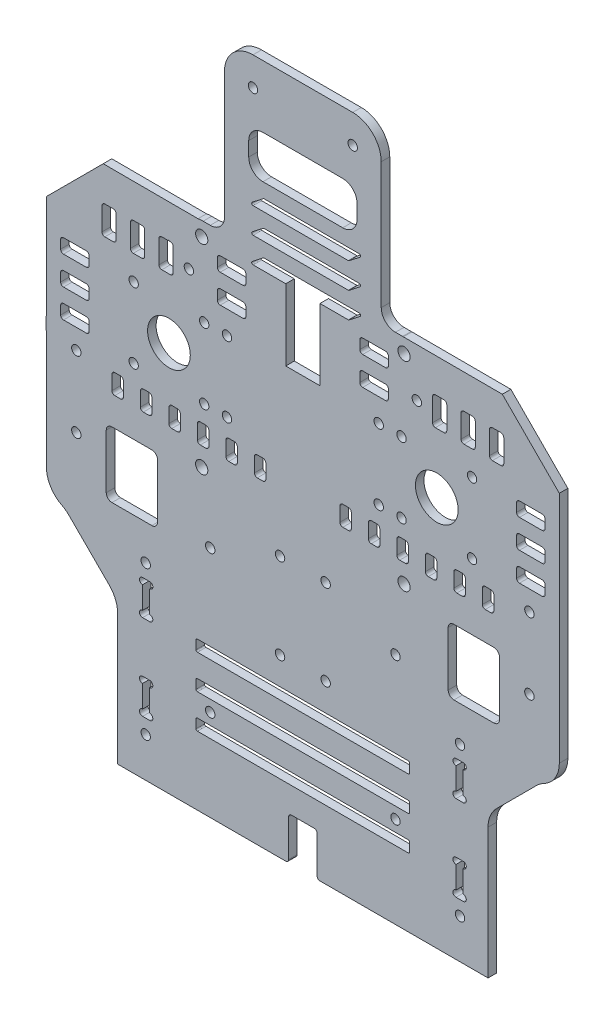
from build123d import *
from OCP.BRepFilletAPI import BRepFilletAPI_MakeChamfer

# Parameters (mm, degrees)
SKETCH_1_W              = 210
SKETCH_1_H              = 150
SKETCH_1_R              = 2.15
EXTRUDE_1_DEPTH         = 3
SKETCH_2_R              = 1.65
CUT_EXTRUDE_1_DEPTH     = 10
SKETCH_3_R              = 7.5
SKETCH_3_R_2            = 1.65
CUT_EXTRUDE_2_DEPTH     = 10
SKETCH_4_W              = 55
SKETCH_4_H              = 3
EXTRUDE_2_DEPTH         = 34.32
FILLET_1_R              = 10
SKETCH_5_R              = 1.65
CUT_EXTRUDE_3_DEPTH     = 50
SKETCH_6_W              = 210
SKETCH_6_H              = 3
EXTRUDE_3_DEPTH         = 50
SKETCH_7_W              = 77.5
SKETCH_7_H              = 25
CUT_EXTRUDE_4_DEPTH     = 50
FILLET_2_R              = 5
CHAMFER_1_SIZE          = 40
CHAMFER_1_SIZE2         = 20
CUT_EXTRUDE_7_DEPTH     = 13
FILLET_3_R              = 2
SKETCH_11_R             = 2.1
CUT_EXTRUDE_8_DEPTH     = 10
SKETCH_12_R             = 2.2
CUT_EXTRUDE_9_DEPTH     = 10
SKETCH_19_W             = 210
SKETCH_19_H             = 3
EXTRUDE_4_DEPTH         = 10
SKETCH_14_W             = 15
SKETCH_14_H             = 200
CUT_EXTRUDE_11_DEPTH    = 10
SKETCH_17_R             = 1.65
CUT_EXTRUDE_14_DEPTH    = 10
SKETCH_20_W             = 26.061880192
SKETCH_20_H             = 15.481160453
CUT_EXTRUDE_16_DEPTH    = 10
FILLET_6_R              = 5
CUT_EXTRUDE_19_DEPTH    = 10
FILLET_7_R              = 12
FILLET_8_R              = 12
EXTRUDE_5_DEPTH         = 3
SKETCH_24_W             = 45
SKETCH_24_H             = 85
CUT_EXTRUDE_20_DEPTH    = 10
SKETCH_25_W             = 90
SKETCH_25_H             = 5
CUT_EXTRUDE_21_DEPTH    = 30
SKETCH_26_R             = 1.65
CUT_EXTRUDE_22_DEPTH    = 10
SKETCH_27_R             = 1.65
CUT_EXTRUDE_23_DEPTH    = 10
EXTRUDE_6_DEPTH         = 3
SKETCH_29_W             = 38
SKETCH_29_H             = 15
CUT_EXTRUDE_24_DEPTH    = 5
FILLET_10_R             = 5
SKETCH_35_R             = 1.844299922
SKETCH_35_R_2           = 3.60582288
SKETCH_35_R_3           = 3.110514485
SKETCH_35_R_4           = 3.033725643
EXTRUDE_7_DEPTH         = 3
SKETCH_36_W             = 20
SKETCH_36_H             = 80
EXTRUDE_8_DEPTH         = 3
CUT_EXTRUDE_30_DEPTH    = 159.201897161
SKETCH_38_R             = 1.65
CUT_EXTRUDE_31_DEPTH    = 12
SKETCH_39_W             = 38
SKETCH_39_H             = 84.431290267
EXTRUDE_9_DEPTH         = 3
CUT_EXTRUDE_32_DEPTH    = 10
FILLET_13_R             = 0.5
SKETCH_42_R             = 1.65
CUT_EXTRUDE_34_DEPTH    = 3
SKETCH_43_W             = 10
SKETCH_43_H             = 30
CUT_EXTRUDE_35_DEPTH    = 10
FILLET_15_R             = 1
SKETCH_44_W             = 25
SKETCH_44_H             = 3
EXTRUDE_10_DEPTH        = 10
SKETCH_9_R              = 1.65
CUT_EXTRUDE_6_DEPTH     = 10
CHAMFER_3_SIZE          = 20
FILLET_16_R             = 10
SKETCH_45_W             = 75
SKETCH_45_H             = 4
CUT_EXTRUDE_36_DEPTH    = 10
FILLET_18_R             = 0.5
FILLET_19_R             = 10
SKETCH_46_W             = 12
SKETCH_46_H             = 25
CUT_EXTRUDE_37_DEPTH    = 10
SKETCH_47_W             = 10
SKETCH_47_H             = 5
SKETCH_47_W_2           = 5
SKETCH_47_H_2           = 10
CUT_EXTRUDE_38_DEPTH    = 10
CUT_EXTRUDE_39_DEPTH    = 10
FILLET_20_R             = 1
FILLET_20_OF_MIRROR_1_R = 1
CUT_EXTRUDE_40_DEPTH    = 10
CHAMFER_4_SIZE          = 20
CHAMFER_4_SIZE2         = 19.949368423
CHAMFER_4_SIZE2_2       = 20.049346643


with BuildPart() as part:
    # 草图1 → 凸台-拉伸1 (new body)
    with BuildSketch(Plane.XY):
        Rectangle(SKETCH_1_W, SKETCH_1_H)
        with Locations((-35.5, 45)):
            Circle(SKETCH_1_R, mode=Mode.SUBTRACT)
        with Locations((35.5, 45)):
            Circle(SKETCH_1_R, mode=Mode.SUBTRACT)
        with Locations((-35.5, -25)):
            Circle(SKETCH_1_R, mode=Mode.SUBTRACT)
        with Locations((35.5, -25)):
            Circle(SKETCH_1_R, mode=Mode.SUBTRACT)
    extrude(amount=EXTRUDE_1_DEPTH)

    # 草图2 → 切除-拉伸1 (cut)
    with BuildSketch(Plane.XY.offset(3)):
        with Locations((-8, -38.3)):
            Circle(SKETCH_2_R)
        with Locations((-8, -68.3)):
            Circle(SKETCH_2_R)
        with Locations((8, -68.3)):
            Circle(SKETCH_2_R)
        with Locations((8, -38.3)):
            Circle(SKETCH_2_R)
    extrude(amount=-CUT_EXTRUDE_1_DEPTH, mode=Mode.SUBTRACT)

    # 草图3 → 切除-拉伸2 (cut)
    with BuildSketch(Plane(origin=(0, 0, 0), x_dir=(-1, 0, 0), z_dir=(0, 0, -1))):
        with Locations((-47, 7)):
            Circle(SKETCH_3_R)
        with Locations(Location((47, 7, 0), (0, 0, 180))):
            Circle(SKETCH_3_R)
        with Locations((-59.374368671, 19.374368671)):
            Circle(SKETCH_3_R_2)
        with Locations((-34.625631329, 19.374368671)):
            Circle(SKETCH_3_R_2)
        with Locations((-59.374368671, -5.374368671)):
            Circle(SKETCH_3_R_2)
        with Locations((-34.625631329, -5.374368671)):
            Circle(SKETCH_3_R_2)
        with Locations(Location((34.625631329, -5.374368671, 0), (0, 0, 180))):
            Circle(SKETCH_3_R_2)
        with Locations(Location((34.625631329, 19.374368671, 0), (0, 0, 180))):
            Circle(SKETCH_3_R_2)
        with Locations(Location((59.374368671, -5.374368671, 0), (0, 0, 180))):
            Circle(SKETCH_3_R_2)
        with Locations(Location((59.374368671, 19.374368671, 0), (0, 0, 180))):
            Circle(SKETCH_3_R_2)
    extrude(amount=-CUT_EXTRUDE_2_DEPTH, mode=Mode.SUBTRACT)

    # 草图4 → 凸台-拉伸2 (add)
    with BuildSketch(Plane(origin=(0, 75, 0), x_dir=(1, 0, 0), z_dir=(0, 1, 0))):
        with Locations((0, -1.5)):
            Rectangle(SKETCH_4_W, SKETCH_4_H)
    extrude(amount=EXTRUDE_2_DEPTH)

    # 圆角1
    fillet_1_edges = [part.edges().sort_by_distance(p)[0] for p in [
        (-27.5, 109.32, 1.5),
        (27.5, 109.32, 1.5),
    ]]
    fillet(fillet_1_edges, radius=FILLET_1_R)

    # 草图5 → 切除-拉伸3 (cut)
    with BuildSketch(Plane.XY.offset(3)):
        with Locations((-17.5, 99.32)):
            Circle(SKETCH_5_R)
        with Locations((17.5, 99.32)):
            Circle(SKETCH_5_R)
    extrude(amount=-CUT_EXTRUDE_3_DEPTH, mode=Mode.SUBTRACT)

    # 草图6 → 凸台-拉伸3 (add)
    with BuildSketch(Plane.XZ.offset(75)):
        with Locations((0, 1.5)):
            Rectangle(SKETCH_6_W, SKETCH_6_H)
    extrude(amount=EXTRUDE_3_DEPTH)

    # 草图7 → 切除-拉伸4 (cut)
    with BuildSketch(Plane.XY.offset(3)):
        with Locations((-66.25, 62.5)):
            Rectangle(SKETCH_7_W, SKETCH_7_H)
        with Locations((66.25, 62.5)):
            Rectangle(SKETCH_7_W, SKETCH_7_H)
    extrude(amount=-CUT_EXTRUDE_4_DEPTH, mode=Mode.SUBTRACT)

    # 圆角2
    fillet_2_edges = [part.edges().sort_by_distance(p)[0] for p in [
        (-27.5, 50, 1.5),
        (27.5, 50, 1.5),
    ]]
    fillet(fillet_2_edges, radius=FILLET_2_R)

    # 倒角1: one chamfer whose edges measure the first distance from different faces: ONE call of the kernel's chamfer builder (chamfer() names one face for all edges)
    chamfer_1_edges_1 = [part.edges().sort_by_distance(p)[0] for p in [
        (105, 50, 1.5),
    ]]
    chamfer_1_side_1 = [part.faces().sort_by_distance(p)[0] for p in [
        (68.75, 50, 1.5),
    ]]
    chamfer_1_edges_2 = [part.edges().sort_by_distance(p)[0] for p in [
        (-105, 50, 1.5),
    ]]
    chamfer_1_side_2 = [part.faces().sort_by_distance(p)[0] for p in [
        (-68.75, 50, 1.5),
    ]]
    chamfer_1 = BRepFilletAPI_MakeChamfer(part.part.solid().wrapped)
    for e in chamfer_1_edges_1:
        chamfer_1.Add(CHAMFER_1_SIZE, CHAMFER_1_SIZE2, e.wrapped, chamfer_1_side_1[0].wrapped)  # the first distance lies on this face
    for e in chamfer_1_edges_2:
        chamfer_1.Add(CHAMFER_1_SIZE, CHAMFER_1_SIZE2, e.wrapped, chamfer_1_side_2[0].wrapped)  # the first distance lies on this face
    add(Compound.cast(chamfer_1.Shape()), mode=Mode.REPLACE)

    # 草图10 → 切除-拉伸7 (cut)
    with BuildSketch(Plane.XY.offset(3)):
        Polygon((19, -13.5), (-19, -13.5), (-19, 28.5), (-10, 28.5), (-10, 60), (10, 60), (10, 28.5), (19, 28.5), align=None)
    extrude(amount=-CUT_EXTRUDE_7_DEPTH, mode=Mode.SUBTRACT)

    # 圆角3
    fillet_3_edges = [part.edges().sort_by_distance(p)[0] for p in [
        (-19, 28.5, 1.5),
        (-10, 28.5, 1.5),
        (-10, 60, 1.5),
        (10, 60, 1.5),
        (10, 28.5, 1.5),
        (19, 28.5, 1.5),
        (19, -13.5, 1.5),
        (-19, -13.5, 1.5),
    ]]
    fillet(fillet_3_edges, radius=FILLET_3_R)

    # 草图11 → 切除-拉伸8 (cut)
    with BuildSketch(Plane.XY.offset(3)):
        with Locations((-14.35, 31.62)):
            Circle(SKETCH_11_R)
        with Locations((14.35, 31.62)):
            Circle(SKETCH_11_R)
    extrude(amount=-CUT_EXTRUDE_8_DEPTH, mode=Mode.SUBTRACT)

    # 草图12 → 切除-拉伸9 (cut)
    with BuildSketch(Plane.XY.offset(3)):
        with Locations((0, -16.21)):
            Circle(SKETCH_12_R)
    extrude(amount=-CUT_EXTRUDE_9_DEPTH, mode=Mode.SUBTRACT)

    # 草图19 → 凸台-拉伸4 (add)
    with BuildSketch(Plane.XZ.offset(125)):
        with Locations((0, 1.5)):
            Rectangle(SKETCH_19_W, SKETCH_19_H)
    extrude(amount=EXTRUDE_4_DEPTH)

    # 草图14 → 切除-拉伸11 (cut)
    with BuildSketch(Plane.XY.offset(3)):
        with Locations((-97.5, -40.90113423)):
            Rectangle(SKETCH_14_W, SKETCH_14_H)
        with Locations((97.5, -29.281318589)):
            Rectangle(SKETCH_14_W, SKETCH_14_H)
    extrude(amount=-CUT_EXTRUDE_11_DEPTH, mode=Mode.SUBTRACT)

    # 草图17 → 切除-拉伸14 (cut)
    with BuildSketch(Plane.XY.offset(3)):
        with Locations((-40, 33)):
            Circle(SKETCH_17_R)
        with Locations((40, 33)):
            Circle(SKETCH_17_R)
    extrude(amount=-CUT_EXTRUDE_14_DEPTH, mode=Mode.SUBTRACT)

    # 草图20 → 切除-拉伸16 (cut)
    with BuildSketch(Plane.XY.offset(3)):
        with Locations((103.030940096, -137.021898815)):
            Rectangle(SKETCH_20_W, SKETCH_20_H)
    extrude(amount=-CUT_EXTRUDE_16_DEPTH, mode=Mode.SUBTRACT)

    # 圆角6
    fillet_6_edges = [part.edges().sort_by_distance(p)[0] for p in [
        (65, 50, 1.5),
        (-65, 50, 1.5),
        (-90, -135, 1.5),
        (90, 37.5, 1.5),
        (-90, 37.5, 1.5),
        (90, -135, 1.5),
    ]]
    fillet(fillet_6_edges, radius=FILLET_6_R)

    # 草图21 → 切除-拉伸19 (cut)
    with BuildSketch(Plane.XY.offset(3)):
        with BuildLine():
            Line((-47, 38), (-47, 50))
            Line((-47, 50), (-106.48364129, 50))
            Line((-106.48364129, 50), (-107.761393927, 0))
            Line((-107.761393927, 0), (-77.199337741, 0))
            ThreePointArc((-77.199337741, 0), (-71.269322199, 26.287301522), (-47, 38))
        make_face()
        with BuildLine():
            Line((78, 7), (106.475131572, 7))
            Line((106.475131572, 7), (106.475131572, 75.573484175))
            Line((106.475131572, 75.573484175), (47, 75.573484175))
            Line((47, 75.573484175), (47, 38))
            ThreePointArc((47, 38), (68.920310217, 28.920310217), (78, 7))
        make_face()
    extrude(amount=-CUT_EXTRUDE_19_DEPTH, mode=Mode.SUBTRACT)

    # 圆角7
    fillet_7_edges = [part.edges().sort_by_distance(p)[0] for p in [
        (90, 7, 1.5),
        (47, 50, 1.5),
        (-90, 0, 1.5),
        (-47, 50, 1.5),
    ]]
    fillet(fillet_7_edges, radius=FILLET_7_R - 0.0001)  # a hair under: the kernel refuses the full size

    # 圆角8
    fillet_8_edges = [part.edges().sort_by_distance(p)[0] for p in [
        (78, 7, 1.5),
        (47, 38, 1.5),
    ]]
    fillet(fillet_8_edges, radius=FILLET_8_R)

    # 草图22 → 凸台-拉伸5 (add)
    with BuildSketch(Plane.XY.offset(3)):
        with BuildLine():
            Line((-90, -12), (-70.972425646, 1.169471724))
            Line((-70.972425646, 1.169471724), (-64.105491041, 22.562614146))
            Line((-64.105491041, 22.562614146), (-46.145815921, 39.069668485))
            Line((-46.145815921, 39.069668485), (-35, 50))
            ThreePointArc((-35, 50), (-75.340620434, 30.390872965), (-90, -12))
        make_face()
        with BuildLine():
            ThreePointArc((45.672505157, 43.486131029), (41.251656887, 48.242889542), (35, 50))
            ThreePointArc((35, 50), (73.890872965, 33.890872965), (90, -5))
            ThreePointArc((90, -5), (88.242889542, 1.251656887), (83.486131029, 5.672505157))
            ThreePointArc((83.486131029, 5.672505157), (79.47417908, 9.01108778), (77.259072646, 13.73710046))
            ThreePointArc((77.259072646, 13.73710046), (68.920310217, 28.920310217), (53.73710046, 37.259072646))
            ThreePointArc((53.73710046, 37.259072646), (49.01108778, 39.47417908), (45.672505157, 43.486131029))
        make_face()
    extrude(amount=-EXTRUDE_5_DEPTH)

    # 草图24 → 切除-拉伸20 (cut)
    with BuildSketch(Plane.XY.offset(3)):
        with Locations((-67.5, -92.5)):
            Rectangle(SKETCH_24_W, SKETCH_24_H)
        with Locations((67.5, -92.5)):
            Rectangle(SKETCH_24_W, SKETCH_24_H)
    extrude(amount=-CUT_EXTRUDE_20_DEPTH, mode=Mode.SUBTRACT)

    # 草图25 → 切除-拉伸21 (cut)
    with BuildSketch(Plane.XY.offset(3)):
        with Locations((0, -132.5)):
            Rectangle(SKETCH_25_W, SKETCH_25_H)
    extrude(amount=-CUT_EXTRUDE_21_DEPTH, mode=Mode.SUBTRACT)

    # 草图26 → 切除-拉伸22 (cut)
    with BuildSketch(Plane.XY.offset(3)):
        with Locations((-32.5, -48)):
            Circle(SKETCH_26_R)
        with Locations((32.5, -48)):
            Circle(SKETCH_26_R)
        with Locations((-32.5, -98)):
            Circle(SKETCH_26_R)
        with Locations((32.5, -98)):
            Circle(SKETCH_26_R)
    extrude(amount=-CUT_EXTRUDE_22_DEPTH, mode=Mode.SUBTRACT)

    # 草图27 → 切除-拉伸23 (cut)
    with BuildSketch(Plane.XY.offset(3)):
        with Locations((-40, -93)):
            Circle(SKETCH_27_R)
        with Locations((40, -93)):
            Circle(SKETCH_27_R)
        with Locations((-40, -125)):
            Circle(SKETCH_27_R)
        with Locations((40, -125)):
            Circle(SKETCH_27_R)
    extrude(amount=-CUT_EXTRUDE_23_DEPTH, mode=Mode.SUBTRACT)

    # 草图28 → 凸台-拉伸6 (add)
    with BuildSketch(Plane.XY.offset(3)):
        with BuildLine():
            Line((-90, -12), (-90, 50))
            Line((-90, 50), (-36.796275006, 49.864796505))
            ThreePointArc((-36.796275006, 49.864796505), (-69.40079096, 24.094680226), (-90, -12))
        make_face()
        with BuildLine():
            Line((90, -5), (90, 49.864796505))
            Line((90, 49.864796505), (35, 50))
            ThreePointArc((35, 50), (68.778091444, 28.778091444), (90, -5))
        make_face()
    extrude(amount=-EXTRUDE_6_DEPTH)

    # 草图29 → 切除-拉伸24 (cut)
    with BuildSketch(Plane.XY.offset(3)):
        with Locations((0, 80)):
            Rectangle(SKETCH_29_W, SKETCH_29_H)
    extrude(amount=-CUT_EXTRUDE_24_DEPTH, mode=Mode.SUBTRACT)

    # 圆角10
    fillet_10_edges = [part.edges().sort_by_distance(p)[0] for p in [
        (-19, 72.5, 1.5),
        (-19, 87.5, 1.5),
        (19, 87.5, 1.5),
        (19, 72.5, 1.5),
    ]]
    fillet(fillet_10_edges, radius=FILLET_10_R)

    # 草图35 → 凸台-拉伸7 (add)
    with BuildSketch(Plane.XY.offset(3)):
        with Locations((-40, -93)):
            Circle(SKETCH_35_R)
        with Locations((-40, -125)):
            Circle(SKETCH_35_R_2)
        with Locations((40, -125)):
            Circle(SKETCH_35_R_3)
        with Locations((40, -93)):
            Circle(SKETCH_35_R_4)
    extrude(amount=-EXTRUDE_7_DEPTH)

    # 草图36 → 凸台-拉伸8 (add)
    with BuildSketch(Plane.XY.offset(3)):
        with Locations((-55, -90)):
            Rectangle(SKETCH_36_W, SKETCH_36_H)
        with Locations((55, -90)):
            Rectangle(SKETCH_36_W, SKETCH_36_H)
    extrude(amount=-EXTRUDE_8_DEPTH)

    # 草图37 → 切除-拉伸30 (cut, through all)
    with BuildSketch(Plane(origin=(0, 0, 0), x_dir=(-1, 0, 0), z_dir=(0, 0, -1))):
        with BuildLine():
            Line((53.75, -81.1), (56.25, -81.1))
            ThreePointArc((56.25, -81.1), (57.35, -80), (56.25, -78.9))
            Line((56.25, -78.9), (56.25, -71.1))
            ThreePointArc((56.25, -71.1), (57.35, -70), (56.25, -68.9))
            Line((56.25, -68.9), (53.75, -68.9))
            ThreePointArc((53.75, -68.9), (52.65, -70), (53.75, -71.1))
            Line((53.75, -71.1), (53.75, -78.9))
            ThreePointArc((53.75, -78.9), (52.65, -80), (53.75, -81.1))
        make_face()
        with BuildLine():
            Line((53.75, -111.1), (56.25, -111.1))
            ThreePointArc((56.25, -111.1), (57.35, -110), (56.25, -108.9))
            Line((56.25, -108.9), (56.25, -101.1))
            ThreePointArc((56.25, -101.1), (57.35, -100), (56.25, -98.9))
            Line((56.25, -98.9), (53.75, -98.9))
            ThreePointArc((53.75, -98.9), (52.65, -100), (53.75, -101.1))
            Line((53.75, -101.1), (53.75, -108.9))
            ThreePointArc((53.75, -108.9), (52.65, -110), (53.75, -111.1))
        make_face()
        with BuildLine():
            Line((-53.75, -98.9), (-56.25, -98.9))
            ThreePointArc((-56.25, -98.9), (-57.35, -100), (-56.25, -101.1))
            Line((-56.25, -101.1), (-56.25, -108.9))
            ThreePointArc((-56.25, -108.9), (-57.35, -110), (-56.25, -111.1))
            Line((-56.25, -111.1), (-53.75, -111.1))
            ThreePointArc((-53.75, -111.1), (-52.65, -110), (-53.75, -108.9))
            Line((-53.75, -108.9), (-53.75, -101.1))
            ThreePointArc((-53.75, -101.1), (-52.65, -100), (-53.75, -98.9))
        make_face()
        with BuildLine():
            Line((-53.75, -81.1), (-56.25, -81.1))
            ThreePointArc((-56.25, -81.1), (-57.35, -80), (-56.25, -78.9))
            Line((-56.25, -78.9), (-56.25, -71.1))
            ThreePointArc((-56.25, -71.1), (-57.35, -70), (-56.25, -68.9))
            Line((-56.25, -68.9), (-53.75, -68.9))
            ThreePointArc((-53.75, -68.9), (-52.65, -70), (-53.75, -71.1))
            Line((-53.75, -71.1), (-53.75, -78.9))
            ThreePointArc((-53.75, -78.9), (-52.65, -80), (-53.75, -81.1))
        make_face()
    extrude(amount=-CUT_EXTRUDE_30_DEPTH, mode=Mode.SUBTRACT)

    # 草图38 → 切除-拉伸31 (cut)
    with BuildSketch(Plane.XY.offset(3)):
        with Locations((-55.15, -63.9)):
            Circle(SKETCH_38_R)
        with Locations((-55.15, -116.1)):
            Circle(SKETCH_38_R)
        with Locations((55.15, -116.1)):
            Circle(SKETCH_38_R)
        with Locations((55.15, -63.9)):
            Circle(SKETCH_38_R)
    extrude(amount=-CUT_EXTRUDE_31_DEPTH, mode=Mode.SUBTRACT)

    # 草图39 → 凸台-拉伸9 (add)
    with BuildSketch(Plane.XY.offset(3)):
        with Locations((0, 17.784354867)):
            Rectangle(SKETCH_39_W, SKETCH_39_H)
    extrude(amount=-EXTRUDE_9_DEPTH)

    # 草图40 → 切除-拉伸32 (cut)
    with BuildSketch(Plane.XY.offset(3)):
        Polygon((-13.772204328, 67.5), (-18.906419704, 63.5), (16.093580296, 63.5), (21.227795672, 67.5), align=None)
        Polygon((-13.772204328, 58.5), (-18.906419704, 54.5), (16.093580296, 54.5), (21.227795672, 58.5), align=None)
        Polygon((-13.772204328, 49.5), (-18.906419704, 45.5), (16.093580296, 45.5), (21.227795672, 49.5), align=None)
    extrude(amount=-CUT_EXTRUDE_32_DEPTH, mode=Mode.SUBTRACT)

    # 圆角13
    fillet_13_edges = [part.edges().sort_by_distance(p)[0] for p in [
        (-13.772204328, 67.5, 1.5),
        (21.227795672, 67.5, 1.5),
        (16.093580296, 63.5, 1.5),
        (-18.906419704, 63.5, 1.5),
        (-13.772204328, 58.5, 1.5),
        (21.227795672, 58.5, 1.5),
        (16.093580296, 54.5, 1.5),
        (-18.906419704, 54.5, 1.5),
        (-13.772204328, 49.5, 1.5),
        (21.227795672, 49.5, 1.5),
        (16.093580296, 45.5, 1.5),
        (-18.906419704, 45.5, 1.5),
    ]]
    fillet(fillet_13_edges, radius=FILLET_13_R)

    # 草图42 → 切除-拉伸34 (cut)
    with BuildSketch(Plane.XY.offset(3)):
        with Locations((-26.625631329, 19.374368671)):
            Circle(SKETCH_42_R)
        with Locations((-26.625631329, -5.374368671)):
            Circle(SKETCH_42_R)
        with Locations(Location((26.625631329, -5.374368671, 0), (0, 0, 180))):
            Circle(SKETCH_42_R)
        with Locations(Location((26.625631329, 19.374368671, 0), (0, 0, 180))):
            Circle(SKETCH_42_R)
    extrude(amount=-CUT_EXTRUDE_34_DEPTH, mode=Mode.SUBTRACT)

    # 草图43 → 切除-拉伸35 (cut)
    with BuildSketch(Plane.XY.offset(3)):
        with Locations((0, -130)):
            Rectangle(SKETCH_43_W, SKETCH_43_H)
    extrude(amount=-CUT_EXTRUDE_35_DEPTH, mode=Mode.SUBTRACT)

    # 圆角15
    fillet_15_edges = [part.edges().sort_by_distance(p)[0] for p in [
        (5, -130, 1.5),
        (-5, -130, 1.5),
        (-5, -115, 1.5),
        (5, -115, 1.5),
    ]]
    fillet(fillet_15_edges, radius=FILLET_15_R)

    # 草图44 → 凸台-拉伸10 (add)
    with BuildSketch(Plane.XZ.offset(50)):
        with Locations((-77.5, 1.5)):
            Rectangle(SKETCH_44_W, SKETCH_44_H)
        with Locations((77.5, 1.5)):
            Rectangle(SKETCH_44_W, SKETCH_44_H)
    extrude(amount=EXTRUDE_10_DEPTH)

    # 草图9 → 切除-拉伸6 (cut)
    with BuildSketch(Plane.XY.offset(3)):
        with Locations((-79.5, -11.5)):
            Circle(SKETCH_9_R)
        with Locations((-79.5, -36.5)):
            Circle(SKETCH_9_R)
        with Locations((79.5, -36.5)):
            Circle(SKETCH_9_R)
        with Locations((79.5, -11.5)):
            Circle(SKETCH_9_R)
    extrude(amount=-CUT_EXTRUDE_6_DEPTH, mode=Mode.SUBTRACT)

    # 倒角3
    chamfer_3_edges = [part.edges().sort_by_distance(p)[0] for p in [
        (-65, -60, 1.5),
        (65, -60, 1.5),
    ]]
    chamfer(chamfer_3_edges, length=CHAMFER_3_SIZE)

    # 圆角16
    fillet_16_edges = [part.edges().sort_by_distance(p)[0] for p in [
        (85, -60, 1.5),
        (65, -80, 1.5),
        (-85, -60, 1.5),
        (-65, -80, 1.5),
    ]]
    fillet(fillet_16_edges, radius=FILLET_16_R)

    # 草图45 → 切除-拉伸36 (cut)
    with BuildSketch(Plane.XY.offset(3)):
        with Locations((0, -80)):
            Rectangle(SKETCH_45_W, SKETCH_45_H)
        with Locations((0, -92)):
            Rectangle(SKETCH_45_W, SKETCH_45_H)
        with Locations((0, -104)):
            Rectangle(SKETCH_45_W, SKETCH_45_H)
    extrude(amount=-CUT_EXTRUDE_36_DEPTH, mode=Mode.SUBTRACT)

    # 圆角18
    fillet_18_edges = [part.edges().sort_by_distance(p)[0] for p in [
        (-37.5, -82, 1.5),
        (-37.5, -78, 1.5),
        (37.5, -78, 1.5),
        (37.5, -82, 1.5),
        (37.5, -94, 1.5),
        (-37.5, -94, 1.5),
        (-37.5, -90, 1.5),
        (37.5, -90, 1.5),
        (37.5, -106, 1.5),
        (-37.5, -106, 1.5),
        (-37.5, -102, 1.5),
        (37.5, -102, 1.5),
    ]]
    fillet(fillet_18_edges, radius=FILLET_18_R)

    # 圆角19
    fillet_19_edges = [part.edges().sort_by_distance(p)[0] for p in [
        (-90, -60, 1.5),
        (90, -60, 1.5),
    ]]
    fillet(fillet_19_edges, radius=FILLET_19_R)

    # 草图46 → 切除-拉伸37 (cut)
    with BuildSketch(Plane(origin=(0, 0, 0), x_dir=(-1, 0, 0), z_dir=(0, 0, -1))):
        with Locations((0, 33)):
            Rectangle(SKETCH_46_W, SKETCH_46_H)
    extrude(amount=-CUT_EXTRUDE_37_DEPTH, mode=Mode.SUBTRACT)

    # 草图47 → 切除-拉伸38 (cut)
    with BuildSketch(Plane(origin=(0, 0, 0), x_dir=(-1, 0, 0), z_dir=(0, 0, -1))):
        with Locations((-25, 40)):
            Rectangle(SKETCH_47_W, SKETCH_47_H)
        with Locations((-25, 30)):
            Rectangle(SKETCH_47_W, SKETCH_47_H)
        with Locations((-48, 33)):
            Rectangle(SKETCH_47_W_2, SKETCH_47_H_2)
        with Locations((-58, 33)):
            Rectangle(SKETCH_47_W_2, SKETCH_47_H_2)
        with Locations((-68, 33)):
            Rectangle(SKETCH_47_W_2, SKETCH_47_H_2)
        with Locations((-80, 18)):
            Rectangle(SKETCH_47_W, SKETCH_47_H)
        with Locations((-80, 8)):
            Rectangle(SKETCH_47_W, SKETCH_47_H)
        with Locations((-80, -2)):
            Rectangle(SKETCH_47_W, SKETCH_47_H)
    cut_extrude_38 = extrude(amount=-CUT_EXTRUDE_38_DEPTH, mode=Mode.SUBTRACT)

    # 草图48 → 切除-拉伸39 (cut)
    with BuildSketch(Plane(origin=(0, 0, 0), x_dir=(-1, 0, 0), z_dir=(0, 0, -1))):
        with BuildLine():
            Line((-23, -17.5), (-23, -12.5))
            ThreePointArc((-23, -12.5), (-23.292893219, -11.792893219), (-24, -11.5))
            Line((-24, -11.5), (-26, -11.5))
            ThreePointArc((-26, -11.5), (-26.707106781, -11.792893219), (-27, -12.5))
            Line((-27, -12.5), (-27, -17.5))
            ThreePointArc((-27, -17.5), (-26.707106781, -18.207106781), (-26, -18.5))
            Line((-26, -18.5), (-24, -18.5))
            ThreePointArc((-24, -18.5), (-23.292893219, -18.207106781), (-23, -17.5))
        make_face()
        with BuildLine():
            Line((-14, -18.5), (-16, -18.5))
            ThreePointArc((-16, -18.5), (-16.707106781, -18.207106781), (-17, -17.5))
            Line((-17, -17.5), (-17, -12.5))
            ThreePointArc((-17, -12.5), (-16.707106781, -11.792893219), (-16, -11.5))
            Line((-16, -11.5), (-14, -11.5))
            ThreePointArc((-14, -11.5), (-13.292893219, -11.792893219), (-13, -12.5))
            Line((-13, -12.5), (-13, -17.5))
            ThreePointArc((-13, -17.5), (-13.292893219, -18.207106781), (-14, -18.5))
        make_face()
        with BuildLine():
            Line((-33, -17.5), (-33, -12.5))
            ThreePointArc((-33, -12.5), (-33.292893219, -11.792893219), (-34, -11.5))
            Line((-34, -11.5), (-36, -11.5))
            ThreePointArc((-36, -11.5), (-36.707106781, -11.792893219), (-37, -12.5))
            Line((-37, -12.5), (-37, -17.5))
            ThreePointArc((-37, -17.5), (-36.707106781, -18.207106781), (-36, -18.5))
            Line((-36, -18.5), (-34, -18.5))
            ThreePointArc((-34, -18.5), (-33.292893219, -18.207106781), (-33, -17.5))
        make_face()
        with BuildLine():
            Line((-43, -17.5), (-43, -12.5))
            ThreePointArc((-43, -12.5), (-43.292893219, -11.792893219), (-44, -11.5))
            Line((-44, -11.5), (-46, -11.5))
            ThreePointArc((-46, -11.5), (-46.707106781, -11.792893219), (-47, -12.5))
            Line((-47, -12.5), (-47, -17.5))
            ThreePointArc((-47, -17.5), (-46.707106781, -18.207106781), (-46, -18.5))
            Line((-46, -18.5), (-44, -18.5))
            ThreePointArc((-44, -18.5), (-43.292893219, -18.207106781), (-43, -17.5))
        make_face()
        with BuildLine():
            Line((-53, -17.5), (-53, -12.5))
            ThreePointArc((-53, -12.5), (-53.292893219, -11.792893219), (-54, -11.5))
            Line((-54, -11.5), (-56, -11.5))
            ThreePointArc((-56, -11.5), (-56.707106781, -11.792893219), (-57, -12.5))
            Line((-57, -12.5), (-57, -17.5))
            ThreePointArc((-57, -17.5), (-56.707106781, -18.207106781), (-56, -18.5))
            Line((-56, -18.5), (-54, -18.5))
            ThreePointArc((-54, -18.5), (-53.292893219, -18.207106781), (-53, -17.5))
        make_face()
        with BuildLine():
            Line((-63, -17.5), (-63, -12.5))
            ThreePointArc((-63, -12.5), (-63.292893219, -11.792893219), (-64, -11.5))
            Line((-64, -11.5), (-66, -11.5))
            ThreePointArc((-66, -11.5), (-66.707106781, -11.792893219), (-67, -12.5))
            Line((-67, -12.5), (-67, -17.5))
            ThreePointArc((-67, -17.5), (-66.707106781, -18.207106781), (-66, -18.5))
            Line((-66, -18.5), (-64, -18.5))
            ThreePointArc((-64, -18.5), (-63.292893219, -18.207106781), (-63, -17.5))
        make_face()
    cut_extrude_39 = extrude(amount=-CUT_EXTRUDE_39_DEPTH, mode=Mode.SUBTRACT)

    # 圆角20
    fillet_20_edges = [part.edges().sort_by_distance(p)[0] for p in [
        (85, -4.5, 1.5),
        (85, 0.5, 1.5),
        (75, 0.5, 1.5),
        (75, -4.5, 1.5),
        (85, 5.5, 1.5),
        (85, 10.5, 1.5),
        (75, 10.5, 1.5),
        (75, 5.5, 1.5),
        (75, 20.5, 1.5),
        (75, 15.5, 1.5),
        (85, 15.5, 1.5),
        (85, 20.5, 1.5),
        (65.5, 38, 1.5),
        (65.5, 28, 1.5),
        (70.5, 28, 1.5),
        (70.5, 38, 1.5),
        (60.5, 28, 1.5),
        (60.5, 38, 1.5),
        (55.5, 38, 1.5),
        (55.5, 28, 1.5),
        (50.5, 28, 1.5),
        (50.5, 38, 1.5),
        (45.5, 38, 1.5),
        (45.5, 28, 1.5),
        (30, 27.5, 1.5),
        (30, 32.5, 1.5),
        (20, 32.5, 1.5),
        (20, 27.5, 1.5),
        (30, 37.5, 1.5),
        (30, 42.5, 1.5),
        (20, 42.5, 1.5),
        (20, 37.5, 1.5),
    ]]
    fillet(fillet_20_edges, radius=FILLET_20_R)

    # 镜向1: 切除-拉伸38, 切除-拉伸39 across plane
    add(cut_extrude_38.mirror(Plane(origin=(0, 0, 0), x_dir=(0, 0, 1), z_dir=(1, 0, 0))), mode=Mode.SUBTRACT)
    add(cut_extrude_39.mirror(Plane(origin=(0, 0, 0), x_dir=(0, 0, 1), z_dir=(1, 0, 0))), mode=Mode.SUBTRACT)

    # 圆角20 of 镜向1
    fillet_20_of_mirror_1_edges = [part.edges().sort_by_distance(p)[0] for p in [
        (-85, -4.5, 1.5),
        (-85, 0.5, 1.5),
        (-75, 0.5, 1.5),
        (-75, -4.5, 1.5),
        (-85, 5.5, 1.5),
        (-85, 10.5, 1.5),
        (-75, 10.5, 1.5),
        (-75, 5.5, 1.5),
        (-75, 20.5, 1.5),
        (-75, 15.5, 1.5),
        (-85, 15.5, 1.5),
        (-85, 20.5, 1.5),
        (-65.5, 38, 1.5),
        (-65.5, 28, 1.5),
        (-70.5, 28, 1.5),
        (-70.5, 38, 1.5),
        (-60.5, 28, 1.5),
        (-60.5, 38, 1.5),
        (-55.5, 38, 1.5),
        (-55.5, 28, 1.5),
        (-50.5, 28, 1.5),
        (-50.5, 38, 1.5),
        (-45.5, 38, 1.5),
        (-45.5, 28, 1.5),
        (-30, 27.5, 1.5),
        (-30, 32.5, 1.5),
        (-20, 32.5, 1.5),
        (-20, 27.5, 1.5),
        (-30, 37.5, 1.5),
        (-30, 42.5, 1.5),
        (-20, 42.5, 1.5),
        (-20, 37.5, 1.5),
    ]]
    fillet(fillet_20_of_mirror_1_edges, radius=FILLET_20_OF_MIRROR_1_R)

    # 草图49 → 切除-拉伸40 (cut)
    with BuildSketch(Plane(origin=(0, 0, 0), x_dir=(-1, 0, 0), z_dir=(0, 0, -1))):
        with BuildLine():
            Line((-53, -51.5), (-67, -51.5))
            ThreePointArc((-67, -51.5), (-68.414213562, -50.914213562), (-69, -49.5))
            Line((-69, -49.5), (-69, -30.5))
            ThreePointArc((-69, -30.5), (-68.414213562, -29.085786438), (-67, -28.5))
            Line((-67, -28.5), (-53, -28.5))
            ThreePointArc((-53, -28.5), (-51.585786438, -29.085786438), (-51, -30.5))
            Line((-51, -30.5), (-51, -49.5))
            ThreePointArc((-51, -49.5), (-51.585786438, -50.914213562), (-53, -51.5))
        make_face()
        with BuildLine():
            Line((67, -51.5), (53, -51.5))
            ThreePointArc((53, -51.5), (51.585786438, -50.914213562), (51, -49.5))
            Line((51, -49.5), (51, -30.5))
            ThreePointArc((51, -30.5), (51.585786438, -29.085786438), (53, -28.5))
            Line((53, -28.5), (67, -28.5))
            ThreePointArc((67, -28.5), (68.414213562, -29.085786438), (69, -30.5))
            Line((69, -30.5), (69, -49.5))
            ThreePointArc((69, -49.5), (68.414213562, -50.914213562), (67, -51.5))
        make_face()
    extrude(amount=-CUT_EXTRUDE_40_DEPTH, mode=Mode.SUBTRACT)

    # 倒角4: one chamfer whose edges measure the first distance from different faces: ONE call of the kernel's chamfer builder (chamfer() names one face for all edges)
    chamfer_4_edges_1 = [part.edges().sort_by_distance(p)[0] for p in [
        (-90, 50, 1.5),
    ]]
    chamfer_4_side_1 = [part.faces().sort_by_distance(p)[0] for p in [
        (-90, 22.5, 1.5),
    ]]
    chamfer_4_edges_2 = [part.edges().sort_by_distance(p)[0] for p in [
        (90, 49.864796505, 1.5),
    ]]
    chamfer_4_side_2 = [part.faces().sort_by_distance(p)[0] for p in [
        (62.635202678, 49.932065891, 1.5),
    ]]
    chamfer_4 = BRepFilletAPI_MakeChamfer(part.part.solid().wrapped)
    for e in chamfer_4_edges_1:
        chamfer_4.Add(CHAMFER_4_SIZE, CHAMFER_4_SIZE2, e.wrapped, chamfer_4_side_1[0].wrapped)  # the first distance lies on this face
    for e in chamfer_4_edges_2:
        chamfer_4.Add(CHAMFER_4_SIZE, CHAMFER_4_SIZE2_2, e.wrapped, chamfer_4_side_2[0].wrapped)  # the first distance lies on this face
    add(Compound.cast(chamfer_4.Shape()), mode=Mode.REPLACE)


solid = part.part
